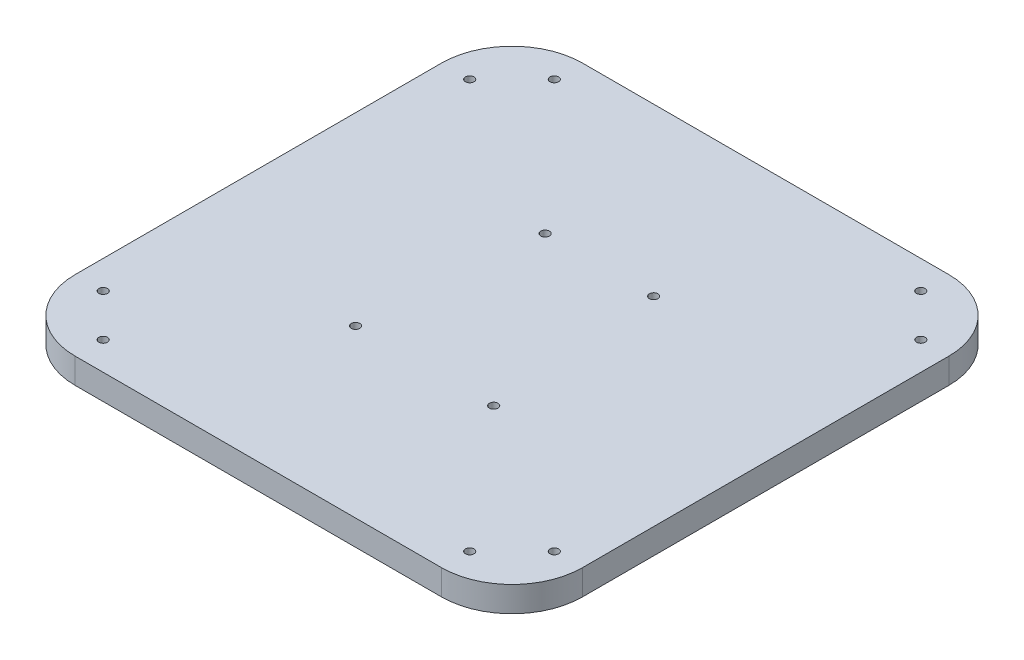
from build123d import *

# Parameters (mm, degrees)
PLATE_DEPTH         = 9
SKETCH3_R           = 1.525
HEX_HOLES_DEPTH     = 128.597021909
SKETCH4_R           = 1.525
ARDUINO_HOLES_DEPTH = 128.597021909


with BuildPart() as part:
    # Sketch1 → Plate (new body)
    with BuildSketch(Plane(origin=(0, 0, 0), x_dir=(1, 0, 0), z_dir=(0, 1, 0))):
        with BuildLine():
            Line((-65, -90), (65, -90))
            ThreePointArc((65, -90), (82.67766953, -82.67766953), (90, -65))
            Line((90, -65), (90, 65))
            ThreePointArc((90, 65), (82.67766953, 82.67766953), (65, 90))
            Line((65, 90), (-65, 90))
            ThreePointArc((-65, 90), (-82.67766953, 82.67766953), (-90, 65))
            Line((-90, 65), (-90, -65))
            ThreePointArc((-90, -65), (-82.67766953, -82.67766953), (-65, -90))
        make_face()
    extrude(amount=PLATE_DEPTH)

    # Sketch3 → Hex Holes (cut, through all)
    with BuildSketch(Plane(origin=(0, 9, 0), x_dir=(1, 0, 0), z_dir=(0, 1, 0))):
        with Locations((-65, 80)):
            Circle(SKETCH3_R)
        with Locations((-80, 65)):
            Circle(SKETCH3_R)
        with Locations((80, 65)):
            Circle(SKETCH3_R)
        with Locations((80, -65)):
            Circle(SKETCH3_R)
        with Locations((65, 80)):
            Circle(SKETCH3_R)
        with Locations((65, -80)):
            Circle(SKETCH3_R)
        with Locations((-65, -80)):
            Circle(SKETCH3_R)
        with Locations((-80, -65)):
            Circle(SKETCH3_R)
    extrude(amount=-HEX_HOLES_DEPTH, mode=Mode.SUBTRACT)

    # Sketch4 → Arduino Holes (cut, through all)
    with BuildSketch(Plane(origin=(0, 9, 0), x_dir=(1, 0, 0), z_dir=(0, 1, 0))):
        with Locations((-24.5, -31)):
            Circle(SKETCH4_R)
        with Locations((24.5, -31)):
            Circle(SKETCH4_R)
        with Locations((-19.25, 31)):
            Circle(SKETCH4_R)
        with Locations((19.25, 31)):
            Circle(SKETCH4_R)
    extrude(amount=-ARDUINO_HOLES_DEPTH, mode=Mode.SUBTRACT)


solid = part.part
